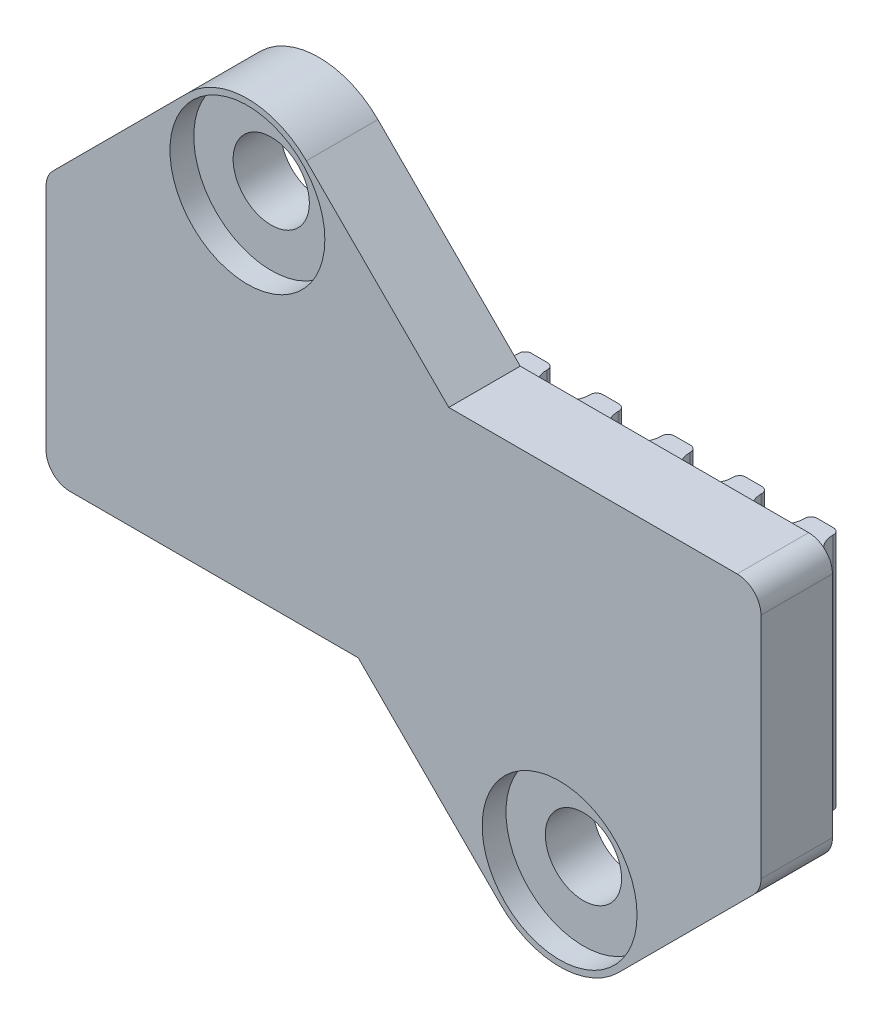
from build123d import *

# Parameters (mm, degrees)
EXTRUDE_1_DEPTH     = 3
SKETCH_3_R          = 3.25
CUT_EXTRUDE_1_DEPTH = 1
EXTRUDE_START       = -0.5
EXTRUDE_2_DEPTH     = 10
SKETCH_5_OUTSIDE_W  = 43.322
SKETCH_5_OUTSIDE_H  = 35.322
CUT_EXTRUDE_2_DEPTH = 22.122026418
FILLET_1_R          = 1
SKETCH_6_R          = 1.6
CUT_EXTRUDE_3_DEPTH = 20.972230797


# Read off the part's stored shape, not the designer's step: 凸台-拉伸1
with BuildPart() as part:
    # 凸台-拉伸1 outline → 凸台-拉伸1 (new body)
    with BuildSketch(Plane.XY):
        with BuildLine():
            Line((15, -5.5), (15, 5.5))
            Line((15, 5.5), (1.899494937, 5.5))
            Line((1.899494937, 5.5), (-4.075378798, 11.474873734))
            ThreePointArc((-4.075378798, 11.474873734), (-6.550252532, 12.5), (-9.025126266, 11.474873734))
            Line((-9.025126266, 11.474873734), (-15, 5.5))
            Line((-15, 5.5), (-15, -5.5))
            Line((-15, -5.5), (-1.899494937, -5.5))
            Line((-1.899494937, -5.5), (4.075378798, -11.474873734))
            ThreePointArc((4.075378798, -11.474873734), (6.550252532, -12.5), (9.025126266, -11.474873734))
            Line((9.025126266, -11.474873734), (15, -5.5))
        make_face()
    extrude(amount=EXTRUDE_1_DEPTH)

    # 草图3 → 切除-拉伸1 (cut)
    with BuildSketch(Plane.XY.offset(3)):
        with Locations((-6.550252532, 9)):
            Circle(SKETCH_3_R)
        with Locations((6.550252532, -9)):
            Circle(SKETCH_3_R)
    extrude(amount=-CUT_EXTRUDE_1_DEPTH, mode=Mode.SUBTRACT)

    # 草图4 → 凸台-拉伸2 (add)
    with BuildSketch(Plane(origin=(0, 5.5, 0), x_dir=(1, 0, 0), z_dir=(0, 1, 0)).offset(EXTRUDE_START)):
        with BuildLine():
            Line((-16.16, 1.2), (-16.5, 1.2))
            Line((-16.5, 1.2), (-16.5, -0.977568186))
            Line((-16.5, -0.977568186), (16.5, -0.977568186))
            Line((16.5, -0.977568186), (16.5, 1.2))
            Line((16.5, 1.2), (16.16, 1.2))
            ThreePointArc((16.16, 1.2), (15.976152237, 1.123847763), (15.9, 0.94))
            Line((15.9, 0.94), (15.9, 0.9))
            ThreePointArc((15.9, 0.9), (15, 0), (14.1, 0.9))
            Line((14.1, 0.9), (14.1, 0.94))
            ThreePointArc((14.1, 0.94), (14.023847763, 1.123847763), (13.84, 1.2))
            Line((13.84, 1.2), (13.5, 1.2))
            Line((13.5, 1.2), (13.16, 1.2))
            ThreePointArc((13.16, 1.2), (12.976152237, 1.123847763), (12.9, 0.94))
            Line((12.9, 0.94), (12.9, 0.9))
            ThreePointArc((12.9, 0.9), (12, 0), (11.1, 0.9))
            Line((11.1, 0.9), (11.1, 0.94))
            ThreePointArc((11.1, 0.94), (11.023847763, 1.123847763), (10.84, 1.2))
            Line((10.84, 1.2), (10.5, 1.2))
            Line((10.5, 1.2), (10.16, 1.2))
            ThreePointArc((10.16, 1.2), (9.976152237, 1.123847763), (9.9, 0.94))
            Line((9.9, 0.94), (9.9, 0.9))
            ThreePointArc((9.9, 0.9), (9, 0), (8.1, 0.9))
            Line((8.1, 0.9), (8.1, 0.94))
            ThreePointArc((8.1, 0.94), (8.023847763, 1.123847763), (7.84, 1.2))
            Line((7.84, 1.2), (7.5, 1.2))
            Line((7.5, 1.2), (7.16, 1.2))
            ThreePointArc((7.16, 1.2), (6.976152237, 1.123847763), (6.9, 0.94))
            Line((6.9, 0.94), (6.9, 0.9))
            ThreePointArc((6.9, 0.9), (6, 0), (5.1, 0.9))
            Line((5.1, 0.9), (5.1, 0.94))
            ThreePointArc((5.1, 0.94), (5.023847763, 1.123847763), (4.84, 1.2))
            Line((4.84, 1.2), (4.5, 1.2))
            Line((4.5, 1.2), (4.16, 1.2))
            ThreePointArc((4.16, 1.2), (3.976152237, 1.123847763), (3.9, 0.94))
            Line((3.9, 0.94), (3.9, 0.9))
            ThreePointArc((3.9, 0.9), (3, 0), (2.1, 0.9))
            Line((2.1, 0.9), (2.1, 0.94))
            ThreePointArc((2.1, 0.94), (2.023847763, 1.123847763), (1.84, 1.2))
            Line((1.84, 1.2), (1.5, 1.2))
            Line((1.5, 1.2), (1.16, 1.2))
            ThreePointArc((1.16, 1.2), (0.976152237, 1.123847763), (0.9, 0.94))
            Line((0.9, 0.94), (0.9, 0.9))
            ThreePointArc((0.9, 0.9), (0, 0), (-0.9, 0.9))
            Line((-0.9, 0.9), (-0.9, 0.94))
            ThreePointArc((-0.9, 0.94), (-0.976152237, 1.123847763), (-1.16, 1.2))
            Line((-1.16, 1.2), (-1.5, 1.2))
            Line((-1.5, 1.2), (-1.84, 1.2))
            ThreePointArc((-1.84, 1.2), (-2.023847763, 1.123847763), (-2.1, 0.94))
            Line((-2.1, 0.94), (-2.1, 0.9))
            ThreePointArc((-2.1, 0.9), (-3, 0), (-3.9, 0.9))
            Line((-3.9, 0.9), (-3.9, 0.94))
            ThreePointArc((-3.9, 0.94), (-3.976152237, 1.123847763), (-4.16, 1.2))
            Line((-4.16, 1.2), (-4.5, 1.2))
            Line((-4.5, 1.2), (-4.84, 1.2))
            ThreePointArc((-4.84, 1.2), (-5.023847763, 1.123847763), (-5.1, 0.94))
            Line((-5.1, 0.94), (-5.1, 0.9))
            ThreePointArc((-5.1, 0.9), (-6, 0), (-6.9, 0.9))
            Line((-6.9, 0.9), (-6.9, 0.94))
            ThreePointArc((-6.9, 0.94), (-6.976152237, 1.123847763), (-7.16, 1.2))
            Line((-7.16, 1.2), (-7.5, 1.2))
            Line((-7.5, 1.2), (-7.84, 1.2))
            ThreePointArc((-7.84, 1.2), (-8.023847763, 1.123847763), (-8.1, 0.94))
            Line((-8.1, 0.94), (-8.1, 0.9))
            ThreePointArc((-8.1, 0.9), (-9, 0), (-9.9, 0.9))
            Line((-9.9, 0.9), (-9.9, 0.94))
            ThreePointArc((-9.9, 0.94), (-9.976152237, 1.123847763), (-10.16, 1.2))
            Line((-10.16, 1.2), (-10.5, 1.2))
            Line((-10.5, 1.2), (-10.84, 1.2))
            ThreePointArc((-10.84, 1.2), (-11.023847763, 1.123847763), (-11.1, 0.94))
            Line((-11.1, 0.94), (-11.1, 0.9))
            ThreePointArc((-11.1, 0.9), (-12, 0), (-12.9, 0.9))
            Line((-12.9, 0.9), (-12.9, 0.94))
            ThreePointArc((-12.9, 0.94), (-12.976152237, 1.123847763), (-13.16, 1.2))
            Line((-13.16, 1.2), (-13.5, 1.2))
            Line((-13.5, 1.2), (-13.84, 1.2))
            ThreePointArc((-13.84, 1.2), (-14.023847763, 1.123847763), (-14.1, 0.94))
            Line((-14.1, 0.94), (-14.1, 0.9))
            ThreePointArc((-14.1, 0.9), (-15, 0), (-15.9, 0.9))
            Line((-15.9, 0.9), (-15.9, 0.94))
            ThreePointArc((-15.9, 0.94), (-15.976152237, 1.123847763), (-16.16, 1.2))
        make_face()
    extrude(amount=-EXTRUDE_2_DEPTH)

    # 草图5 outside → 切除-拉伸2 (cut, through all)
    with BuildSketch(Plane.XY.offset(3)):
        Rectangle(SKETCH_5_OUTSIDE_W, SKETCH_5_OUTSIDE_H)
        with BuildLine():
            Line((15, -5.5), (15, 5.5))
            Line((15, 5.5), (1.899494937, 5.5))
            Line((1.899494937, 5.5), (-4.075378798, 11.474873734))
            ThreePointArc((-4.075378798, 11.474873734), (-6.550252532, 12.5), (-9.025126266, 11.474873734))
            Line((-9.025126266, 11.474873734), (-15, 5.5))
            Line((-15, 5.5), (-15, -5.5))
            Line((-15, -5.5), (-1.899494937, -5.5))
            Line((-1.899494937, -5.5), (4.075378798, -11.474873734))
            ThreePointArc((4.075378798, -11.474873734), (6.550252532, -12.5), (9.025126266, -11.474873734))
            Line((9.025126266, -11.474873734), (15, -5.5))
        make_face(mode=Mode.SUBTRACT)
    extrude(amount=-CUT_EXTRUDE_2_DEPTH, mode=Mode.SUBTRACT)

    # 圆角1
    # the kernel refuses this fillet: 1 mm, written as the material it takes off along each edge
    with BuildSketch(Plane(origin=(15, -5.5, -1.035533906), x_dir=(-0.7071067811865454, -0.7071067811865497, 0), z_dir=(0, 0, 1))) as fillet_1_piece_1:
        with BuildLine():
            CenterArc((FILLET_1_R * 0.414213562373, -FILLET_1_R), FILLET_1_R, 90, 45)
            Line((-FILLET_1_R * 0.292893218813, -FILLET_1_R * 0.292893218813), (0, 0))
            Line((0, 0), (FILLET_1_R * 0.414213562373, 0))
        make_face()
    extrude(amount=5.071067812, mode=Mode.SUBTRACT)
    with BuildSketch(Plane(origin=(-15, -5.5, -2.5), x_dir=(1, 0, 0), z_dir=(0, 0, 1))) as fillet_1_piece_2:
        with BuildLine():
            CenterArc((FILLET_1_R, FILLET_1_R), FILLET_1_R, 180, 90)
            Line((0, FILLET_1_R), (0, 0))
            Line((0, 0), (FILLET_1_R, 0))
        make_face()
    extrude(amount=8, mode=Mode.SUBTRACT)
    with BuildSketch(Plane(origin=(-15, 5.5, -1.035533906), x_dir=(0, -1, 0), z_dir=(0, 0, 1))) as fillet_1_piece_3:
        with BuildLine():
            CenterArc((FILLET_1_R * 0.414213562373, FILLET_1_R), FILLET_1_R, 225, 45)
            Line((-FILLET_1_R * 0.292893218813, FILLET_1_R * 0.292893218813), (0, 0))
            Line((0, 0), (FILLET_1_R * 0.414213562373, 0))
        make_face()
    extrude(amount=5.071067812, mode=Mode.SUBTRACT)
    with BuildSketch(Plane(origin=(15, 5.5, -2.5), x_dir=(0, -1, 0), z_dir=(0, 0, 1))) as fillet_1_piece_4:
        with BuildLine():
            CenterArc((FILLET_1_R, -FILLET_1_R), FILLET_1_R, 90, 90)
            Line((0, -FILLET_1_R), (0, 0))
            Line((0, 0), (FILLET_1_R, 0))
        make_face()
    extrude(amount=8, mode=Mode.SUBTRACT)

    # 草图6 → 切除-拉伸3 (cut, through all)
    with BuildSketch(Plane.XY.offset(3)):
        with Locations((-6.550252532, 9)):
            Circle(SKETCH_6_R)
        with Locations((6.550252532, -9)):
            Circle(SKETCH_6_R)
    extrude(amount=-CUT_EXTRUDE_3_DEPTH, mode=Mode.SUBTRACT)


solid = part.part
